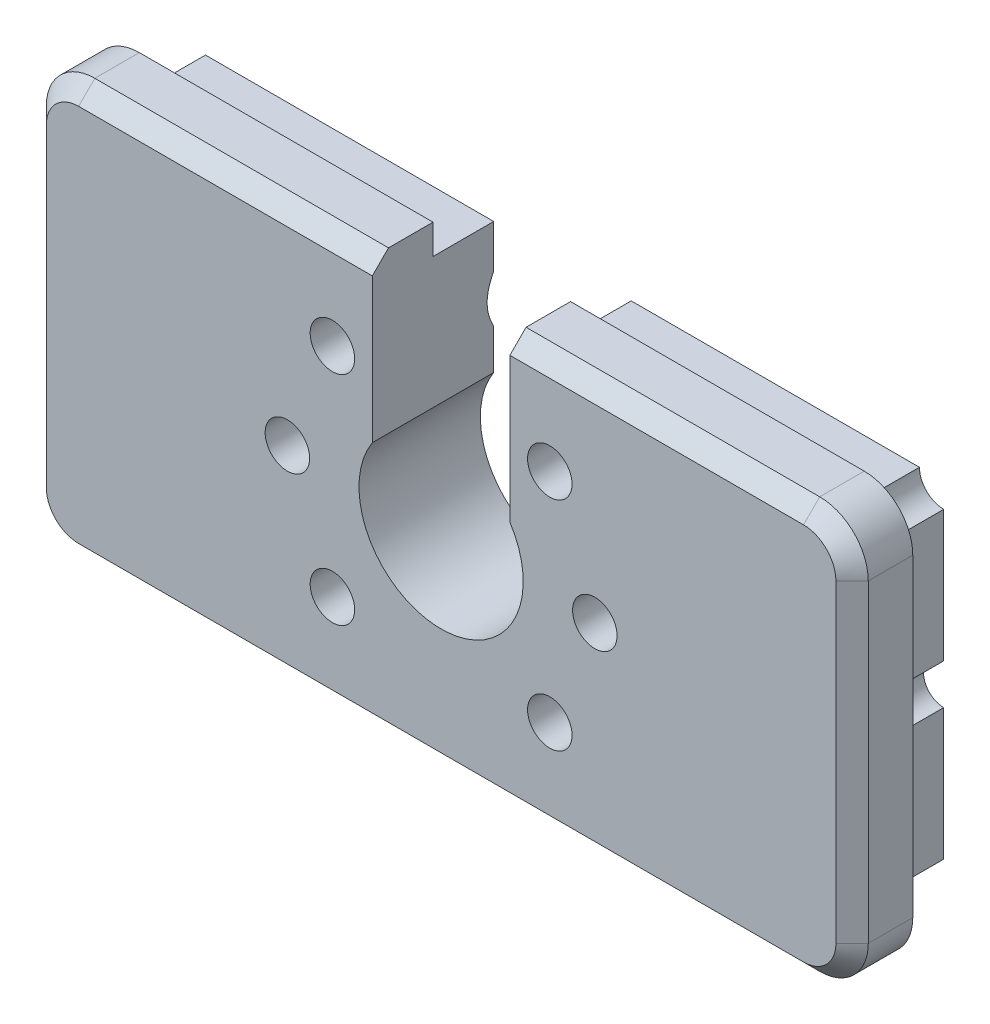
from build123d import *

# Parameters (mm, degrees)
SKETCH1_W           = 101.6
SKETCH1_H           = 50.8
BOSS_EXTRUDE1_DEPTH = 7.5
SKETCH2_W           = 94.25
SKETCH2_H           = 43.45
BOSS_EXTRUDE2_DEPTH = 7.5
SKETCH3_R           = 2.75
CUT_EXTRUDE1_DEPTH  = 59.74351028
FILLET1_R           = 6
SKETCH4_R           = 3
SKETCH4_R_2         = 2.5
CUT_EXTRUDE2_DEPTH  = 7.5
CHAMFER1_SIZE       = 2
CHAMFER2_SIZE       = 3


with BuildPart() as part:
    # Sketch1 → Boss-Extrude1 (new body)
    with BuildSketch(Plane.XY):
        Rectangle(SKETCH1_W, SKETCH1_H)
    extrude(amount=-BOSS_EXTRUDE1_DEPTH)

    # Sketch2 → Boss-Extrude2 (add)
    with BuildSketch(Plane(origin=(0, 0, -7.5), x_dir=(-1, 0, 0), z_dir=(0, 0, -1))):
        Rectangle(SKETCH2_W, SKETCH2_H)
    extrude(amount=BOSS_EXTRUDE2_DEPTH)

    # Sketch3 → Cut-Extrude1 (cut, through all)
    with BuildSketch(Plane.XY):
        with Locations((-19, 0)):
            Circle(SKETCH3_R)
        with Locations((-13.435028843, 13.435028843)):
            Circle(SKETCH3_R)
        with Locations((13.435028843, 13.435028843)):
            Circle(SKETCH3_R)
        with Locations((19, 0)):
            Circle(SKETCH3_R)
        with Locations((13.435028843, -13.435028843)):
            Circle(SKETCH3_R)
        with Locations((-13.435028843, -13.435028843)):
            Circle(SKETCH3_R)
        with BuildLine():
            Line((8.5, 5.547296639), (8.5, 25.4))
            Line((8.5, 25.4), (-8.5, 25.4))
            Line((-8.5, 25.4), (-8.5, 5.547296639))
            ThreePointArc((-8.5, 5.547296639), (0, -10.15), (8.5, 5.547296639))
        make_face()
    extrude(amount=-CUT_EXTRUDE1_DEPTH, mode=Mode.SUBTRACT)

    # Fillet1
    fillet1_edges = [part.edges().sort_by_distance(p)[0] for p in [
        (-50.8, 25.4, -3.75),
        (50.8, 25.4, -3.75),
        (50.8, -25.4, -3.75),
        (-50.8, -25.4, -3.75),
    ]]
    fillet(fillet1_edges, radius=FILLET1_R)

    # Sketch4 → Cut-Extrude2 (cut)
    with BuildSketch(Plane(origin=(0, 0, -15), x_dir=(-1, 0, 0), z_dir=(0, 0, -1))):
        with Locations((-47.125, 21.725)):
            Circle(SKETCH4_R)
        with Locations((-47.125, -21.725)):
            Circle(SKETCH4_R)
        with Locations((-47.125, 0)):
            Circle(SKETCH4_R_2)
        with Locations((0, -21.725)):
            Circle(SKETCH4_R_2)
        with Locations((47.125, -21.725)):
            Circle(SKETCH4_R)
        with Locations((47.125, 0)):
            Circle(SKETCH4_R_2)
        with Locations((47.125, 21.725)):
            Circle(SKETCH4_R)
    extrude(amount=-CUT_EXTRUDE2_DEPTH, mode=Mode.SUBTRACT)

    # Chamfer1
    chamfer1_edges = [part.edges().sort_by_distance(p)[0] for p in [
        (-26.65, 25.4, 0),
        (0, -25.4, 0),
        (-50.8, 0, 0),
        (50.8, 0, 0),
        (26.65, 25.4, 0),
        (49.042640687, 23.642640687, 0),
        (-49.042640687, 23.642640687, 0),
        (-49.042640687, -23.642640687, 0),
        (49.042640687, -23.642640687, 0),
    ]]
    chamfer(chamfer1_edges, length=CHAMFER1_SIZE)

    # Chamfer2
    # the kernel refuses this chamfer: 3 mm, written as the material it takes off along each edge
    with BuildSketch(Plane(origin=(-13.435028843, -13.435028843, -15), x_dir=(1, 0, 0), z_dir=(0, -1, 0))) as chamfer2_piece_1:
        Polygon((2.75, CHAMFER2_SIZE), (2.75 + CHAMFER2_SIZE, 0), (2.75, 0), align=None)
    revolve(axis=Axis((-13.435028843, -13.435028843, -15), (0, 0, 1)), mode=Mode.SUBTRACT)
    with BuildSketch(Plane(origin=(13.435028843, -13.435028843, -15), x_dir=(1, 0, 0), z_dir=(0, -1, 0))) as chamfer2_piece_2:
        Polygon((2.75, CHAMFER2_SIZE), (2.75 + CHAMFER2_SIZE, 0), (2.75, 0), align=None)
    revolve(axis=Axis((13.435028843, -13.435028843, -15), (0, 0, 1)), mode=Mode.SUBTRACT)
    with BuildSketch(Plane(origin=(19, 0, -15), x_dir=(1, 0, 0), z_dir=(0, -1, 0))) as chamfer2_piece_3:
        Polygon((2.75, CHAMFER2_SIZE), (2.75 + CHAMFER2_SIZE, 0), (2.75, 0), align=None)
    revolve(axis=Axis((19, 0, -15), (0, 0, 1)), mode=Mode.SUBTRACT)
    with BuildSketch(Plane(origin=(13.435028843, 13.435028843, -15), x_dir=(1, 0, 0), z_dir=(0, -1, 0))) as chamfer2_piece_4:
        Polygon((2.75, CHAMFER2_SIZE), (2.75 + CHAMFER2_SIZE, 0), (2.75, 0), align=None)
    revolve(axis=Axis((13.435028843, 13.435028843, -15), (0, 0, 1)), mode=Mode.SUBTRACT)
    with BuildSketch(Plane(origin=(-13.435028843, 13.435028843, -15), x_dir=(1, 0, 0), z_dir=(0, -1, 0))) as chamfer2_piece_5:
        Polygon((2.75, CHAMFER2_SIZE), (2.75 + CHAMFER2_SIZE, 0), (2.75, 0), align=None)
    revolve(axis=Axis((-13.435028843, 13.435028843, -15), (0, 0, 1)), mode=Mode.SUBTRACT)
    with BuildSketch(Plane(origin=(-19, 0, -15), x_dir=(1, 0, 0), z_dir=(0, -1, 0))) as chamfer2_piece_6:
        Polygon((2.75, CHAMFER2_SIZE), (2.75 + CHAMFER2_SIZE, 0), (2.75, 0), align=None)
    revolve(axis=Axis((-19, 0, -15), (0, 0, 1)), mode=Mode.SUBTRACT)


solid = part.part
